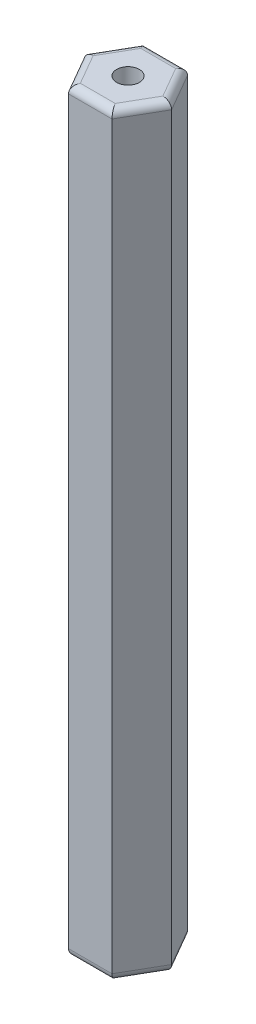
from build123d import *

# Parameters (mm, degrees)
RESSALTO_EXTRUS_O1_DEPTH = 50
FILETE1_R                = 0.5
ESBO_O2_R                = 0.751353762
CORTE_EXTRUS_O1_DEPTH    = 51.145621278


with BuildPart() as part:
    # Esboço1 → Ressalto-extrusão1 (new body)
    with BuildSketch(Plane.XZ.offset(30)):
        Polygon((-1.443375673, -2.5), (1.443375673, -2.5), (2.886751346, 0), (1.443375673, 2.5), (-1.443375673, 2.5), (-2.886751346, 0), align=None)
    extrude(amount=-RESSALTO_EXTRUS_O1_DEPTH)

    # Filete1
    filete1_edges = [part.edges().sort_by_distance(p)[0] for p in [
        (0, -30, 2.5),
        (2.165063509, -30, 1.25),
        (-2.165063509, -30, 1.25),
        (2.165063509, -30, -1.25),
        (-2.165063509, -30, -1.25),
        (0, -30, -2.5),
        (0, 20, 2.5),
        (2.165063509, 20, 1.25),
        (-2.165063509, 20, 1.25),
        (2.165063509, 20, -1.25),
        (-2.165063509, 20, -1.25),
        (0, 20, -2.5),
    ]]
    fillet(filete1_edges, radius=FILETE1_R)

    # Esboço2 → Corte-extrusão1 (cut, through all)
    with BuildSketch(Plane.XZ.offset(30)):
        Circle(ESBO_O2_R)
    extrude(amount=-CORTE_EXTRUS_O1_DEPTH, mode=Mode.SUBTRACT)


solid = part.part
